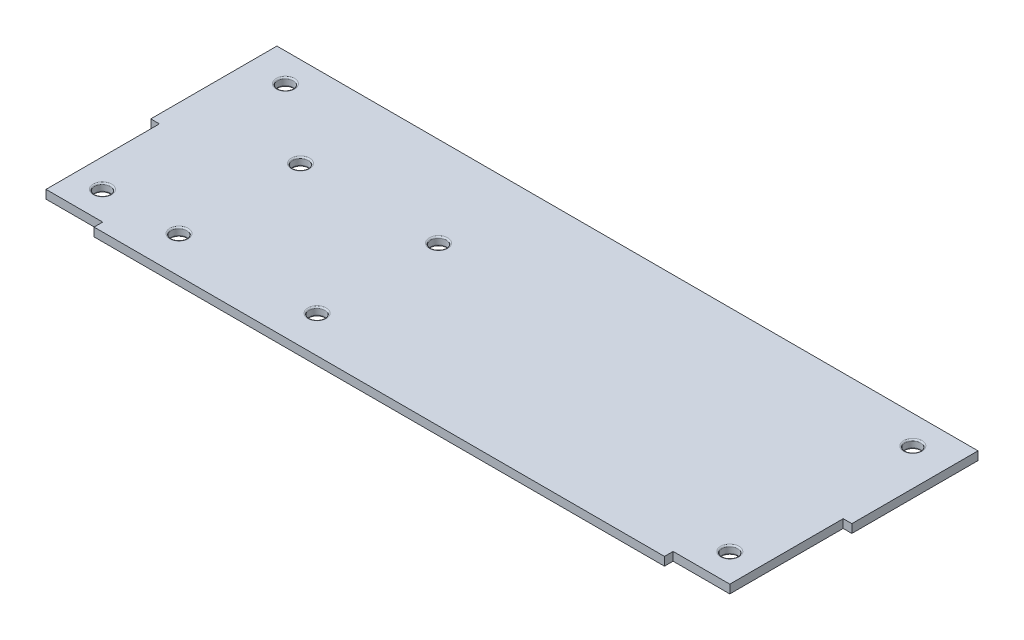
from build123d import *

# Parameters (mm, degrees)
SKETCH1_W           = 247.3
SKETCH1_H           = 87.55
BOSS_EXTRUDE1_DEPTH = 3
CUT_EXTRUDE2_DEPTH  = 132.204318241
SKETCH2_R           = 2.75
CUT_EXTRUDE1_DEPTH  = 132.204318241
FILLET1_R           = 0.5
SKETCH11_R          = 2.75
CUT_EXTRUDE9_DEPTH  = 132.204318241
FILLET5_R           = 0.5


with BuildPart() as part:
    # Sketch1 → Boss-Extrude1 (new body)
    with BuildSketch(Plane(origin=(0, 0, 0), x_dir=(1, 0, 0), z_dir=(0, 1, 0))):
        Rectangle(SKETCH1_W, SKETCH1_H)
    extrude(amount=BOSS_EXTRUDE1_DEPTH)

    # Sketch4 → Cut-Extrude2 (cut, through all)
    with BuildSketch(Plane(origin=(0, 3, 0), x_dir=(1, 0, 0), z_dir=(0, 1, 0))):
        Polygon((-123.65, -43.775), (-120.6, -43.775), (-100.6, -43.775), (-100.6, -40.725), (-120.6, -40.725), (-120.6, -0.725), (-123.65, -0.725), align=None)
        Polygon((100.6, -43.775), (100.6, -40.725), (120.6, -40.725), (120.6, -0.725), (123.65, -0.725), (123.65, -43.775), (120.6, -43.775), align=None)
    extrude(amount=-CUT_EXTRUDE2_DEPTH, mode=Mode.SUBTRACT)

    # Sketch2 → Cut-Extrude1 (cut, through all)
    with BuildSketch(Plane(origin=(0, 3, 0), x_dir=(1, 0, 0), z_dir=(0, 1, 0))):
        with Locations((-110.65, 33.775)):
            Circle(SKETCH2_R)
        with Locations((110.65, 33.775)):
            Circle(SKETCH2_R)
        with Locations((-110.65, -30.775)):
            Circle(SKETCH2_R)
        with Locations((110.65, -30.775)):
            Circle(SKETCH2_R)
    extrude(amount=-CUT_EXTRUDE1_DEPTH, mode=Mode.SUBTRACT)

    # Fillet1
    fillet1_edges = [part.edges().sort_by_distance(p)[0] for p in [
        (-113.4, 3, -33.775),
        (-113.4, 0, -33.775),
        (107.9, 3, -33.775),
        (107.9, 0, -33.775),
        (-113.4, 3, 30.775),
        (-113.4, 0, 30.775),
        (107.9, 3, 30.775),
        (107.9, 0, 30.775),
    ]]
    fillet(fillet1_edges, radius=FILLET1_R)

    # Sketch11 → Cut-Extrude9 (cut, through all)
    with BuildSketch(Plane(origin=(0, 3, 0), x_dir=(1, 0, 0), z_dir=(0, 1, 0))):
        with Locations((-83.65, -30.775)):
            Circle(SKETCH11_R)
        with Locations((-34.957854175, -30.775)):
            Circle(SKETCH11_R)
        with Locations((-34.957854175, 12.075316858)):
            Circle(SKETCH11_R)
        with Locations((-83.65, 12.075316858)):
            Circle(SKETCH11_R)
    extrude(amount=-CUT_EXTRUDE9_DEPTH, mode=Mode.SUBTRACT)

    # Fillet5
    fillet5_edges = [part.edges().sort_by_distance(p)[0] for p in [
        (-86.4, 3, 30.775),
        (-86.4, 0, 30.775),
        (-37.707854175, 3, 30.775),
        (-37.707854175, 0, 30.775),
        (-37.707854175, 3, -12.075316858),
        (-37.707854175, 0, -12.075316858),
        (-86.4, 3, -12.075316858),
        (-86.4, 0, -12.075316858),
    ]]
    fillet(fillet5_edges, radius=FILLET5_R)


solid = part.part
